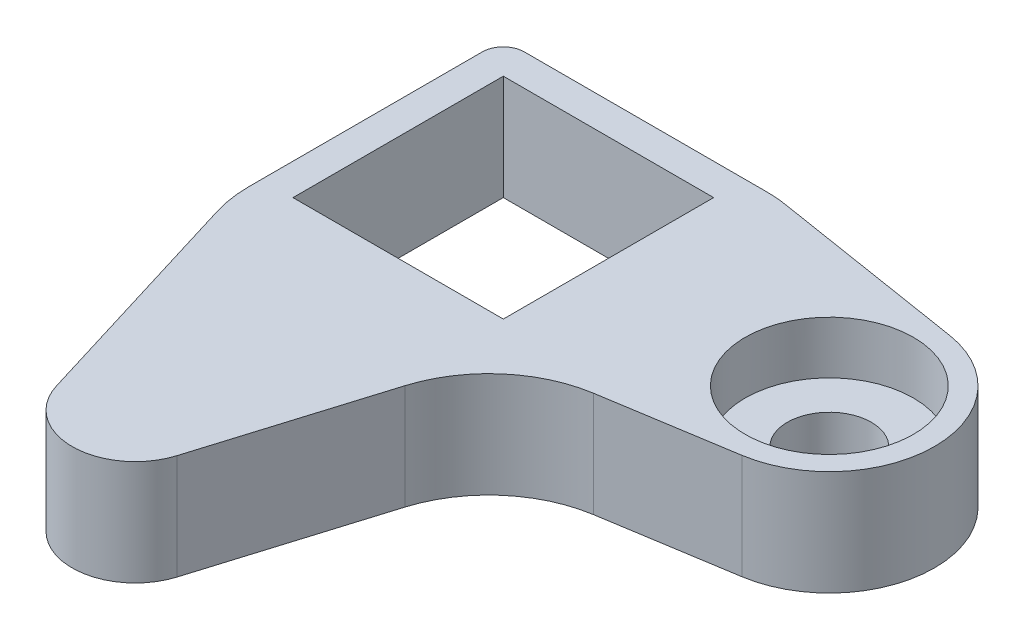
from build123d import *

# Parameters (mm, degrees)
SKETCH1_W           = 20
SKETCH1_H           = 20
BOSS_EXTRUDE1_DEPTH = 10
SKETCH2_R           = 8
CUT_EXTRUDE2_DEPTH  = 46
SKETCH3_R           = 4
CUT_EXTRUDE4_DEPTH  = 36


with BuildPart() as part:
    # Sketch1 → Boss-Extrude1 (new body)
    with BuildSketch(Plane(origin=(0, 0, 0), x_dir=(1, 0, 0), z_dir=(0, 1, 0))):
        with BuildLine():
            Line((23.939871077, 2.849965846), (42.576368333, -0.125028462))
            ThreePointArc((42.576368333, -0.125028462), (51, -10), (42.576368333, -19.874971538))
            Line((42.576368333, -19.874971538), (30.394725659, -21.819560004))
            ThreePointArc((30.394725659, -21.819560004), (24.408108439, -24.617839175), (20.810680125, -30.161165034))
            Line((20.810680125, -30.161165034), (15.737843767, -46.754180408))
            ThreePointArc((15.737843767, -46.754180408), (10, -51), (4.262156233, -46.754180408))
            Line((4.262156233, -46.754180408), (-2.475687534, -24.71500206))
            ThreePointArc((-2.475687534, -24.71500206), (-2.868198061, -22.980302653), (-3, -21.206641244))
            Line((-3, -21.206641244), (-3, 1))
            ThreePointArc((-3, 1), (-2.414213562, 2.414213562), (-1, 3))
            Line((-1, 3), (22.048229077, 3))
            ThreePointArc((22.048229077, 3), (22.997020375, 2.962432657), (23.939871077, 2.849965846))
        make_face()
        with Locations((10, -10)):
            Rectangle(SKETCH1_W, SKETCH1_H, mode=Mode.SUBTRACT)
    extrude(amount=BOSS_EXTRUDE1_DEPTH)

    # Sketch2 → Cut-Extrude2 (cut)
    with BuildSketch(Plane(origin=(0, 5, 0), x_dir=(1, 0, 0), z_dir=(0, 1, 0))):
        with Locations((41, -10)):
            Circle(SKETCH2_R)
    extrude(amount=CUT_EXTRUDE2_DEPTH, mode=Mode.SUBTRACT)

    # Sketch3 → Cut-Extrude4 (cut)
    with BuildSketch(Plane(origin=(0, 5, -5), x_dir=(1, 0, 0), z_dir=(0, -1, 0))):
        with Locations((41, 15)):
            Circle(SKETCH3_R)
        with Locations((10, 50)):
            Circle(SKETCH3_R)
    extrude(amount=CUT_EXTRUDE4_DEPTH, mode=Mode.SUBTRACT)


solid = part.part
